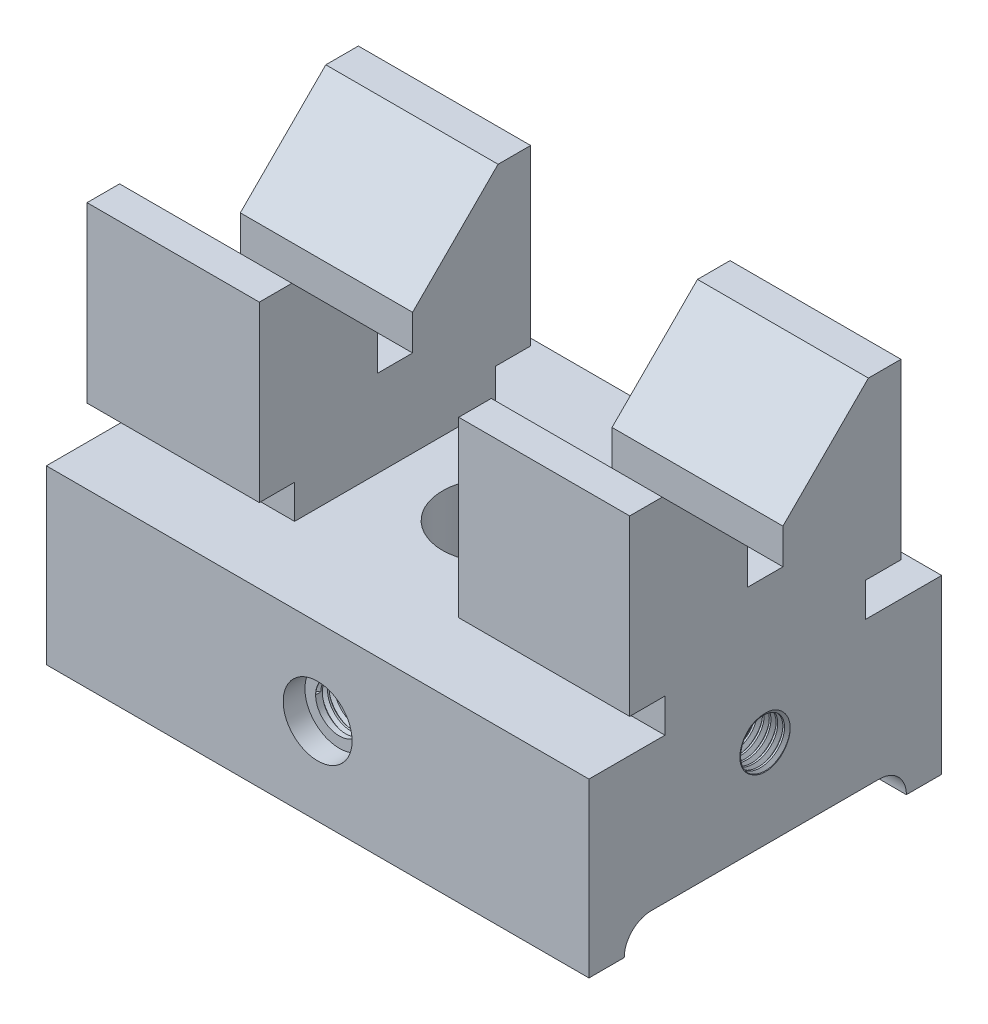
from build123d import *

# Parameters (mm, degrees)
SKETCH1_W                                = 65
SKETCH1_H                                = 70
BOSS_EXTRUDE1_DEPTH                      = 50
SKETCH2_W                                = 26
SKETCH2_H                                = 5
CUT_EXTRUDE1_DEPTH                       = 111.820801297
FILLET1_R                                = 5
CUT_EXTRUDE2_START                       = -31.75
CUT_EXTRUDE2_DEPTH                       = 36.75
SKETCH5_R                                = 9.5
CUT_EXTRUDE3_DEPTH                       = 71.847106504
CBORE_FOR_M10_HEX_HEAD_BOLT1_D           = 8.75
CBORE_FOR_M10_HEX_HEAD_BOLT1_DEPTH       = 20
CBORE_FOR_M10_HEX_HEAD_BOLT1_CBORE_D     = 12.7
CBORE_FOR_M10_HEX_HEAD_BOLT1_CBORE_DEPTH = 4
CBORE_FOR_M10_HEX_HEAD_BOLT1_TIP         = 2.628765208
THREAD1_PITCH                            = 1.25
F_8_7_8_7_DIAMETER_HOLE1_D               = 8.7
F_8_7_8_7_DIAMETER_HOLE1_DEPTH           = 16
F_8_7_8_7_DIAMETER_HOLE1_TIP             = 2.613743693
THREAD2_PITCH                            = 1.25


with BuildPart() as part:
    # Sketch1 → Boss-Extrude1 (new, symmetric)
    with BuildSketch(Plane(origin=(0, 0, 0), x_dir=(0, 0, -1), z_dir=(1, 0, 0))):
        Rectangle(SKETCH1_W, SKETCH1_H)
    extrude(amount=BOSS_EXTRUDE1_DEPTH, both=True)

    # Sketch2 → Cut-Extrude1 (cut, through all)
    with BuildSketch(Plane(origin=(50, 0, 0), x_dir=(0, 0, -1), z_dir=(1, 0, 0))):
        Polygon((-25, 18.646228615), (-25, 35), (-32.5, 35), (-32.5, -3.25), (-18.5, -3.25), (-18.5, 3), (-25, 3), align=None)
        Polygon((32.5, 35), (25, 35), (25, 18.646228615), (25, 3), (18.5, 3), (18.5, -3.25), (32.5, -3.25), align=None)
        Polygon((19, 35), (0, 35), (0, 12.75), (3.25, 12.75), (3.25, 19.25), align=None)
        Polygon((0, 12.75), (0, 35), (-19, 35), (-3.25, 19.25), (-3.25, 12.75), align=None)
        with Locations((13, -32.5)):
            Rectangle(SKETCH2_W, SKETCH2_H)
        with Locations((-13, -32.5)):
            Rectangle(SKETCH2_W, SKETCH2_H)
    extrude(amount=-CUT_EXTRUDE1_DEPTH, mode=Mode.SUBTRACT)

    # Fillet1
    fillet1_edges = [part.edges().sort_by_distance(p)[0] for p in [
        (0, -30, 26),
        (0, -30, -26),
    ]]
    fillet(fillet1_edges, radius=FILLET1_R - 0.0001)  # a hair under: the kernel refuses the full size

    # Sketch4 → Cut-Extrude2 (cut)
    with BuildSketch(Plane.ZY.offset(50).offset(CUT_EXTRUDE2_START)):
        Polygon((-18.5, -3.25), (18.5, -3.25), (18.5, 3), (25, 3), (25, 35), (19, 35), (3.25, 19.25), (3.25, 12.75), (-3.25, 12.75), (-3.25, 19.25), (-19, 35), (-25, 35), (-25, 3), (-18.5, 3), align=None)
    extrude(amount=-CUT_EXTRUDE2_DEPTH, mode=Mode.SUBTRACT)

    # Sketch5 → Cut-Extrude3 (cut, through all)
    with BuildSketch(Plane(origin=(0, -3.25, 0), x_dir=(1, 0, 0), z_dir=(0, 1, 0))):
        with Locations(Location((0, 0, 0), (0, 0, 270))):
            Circle(SKETCH5_R)
    extrude(amount=-CUT_EXTRUDE3_DEPTH, mode=Mode.SUBTRACT)

    # CBORE for M10 Hex Head Bolt1
    with Locations(Plane.XY.offset(32.5)):
        with Locations((0, -19)):
            CounterBoreHole(CBORE_FOR_M10_HEX_HEAD_BOLT1_D / 2, CBORE_FOR_M10_HEX_HEAD_BOLT1_CBORE_D / 2, CBORE_FOR_M10_HEX_HEAD_BOLT1_CBORE_DEPTH, depth=CBORE_FOR_M10_HEX_HEAD_BOLT1_DEPTH)
            with Locations((0, 0, -(CBORE_FOR_M10_HEX_HEAD_BOLT1_DEPTH + CBORE_FOR_M10_HEX_HEAD_BOLT1_TIP / 2))):  # 118° drill point
                Cone(0, CBORE_FOR_M10_HEX_HEAD_BOLT1_D / 2, CBORE_FOR_M10_HEX_HEAD_BOLT1_TIP, mode=Mode.SUBTRACT)

    # Thread1: the profile of Thread Profile1 profile screwed along a right-hand helix of 8 turns, 8 arcs to a turn; built about Z, then put on its axis
    thread1_z = Axis((0, 0, 0), (0, 0, 1))
    thread1_corners = [(4.3747, 0, -0.000173205), (5.051582344, 0, 0.390624998), (5.051582344, 0, 0.546874998), (4.3747, 0, 0.937673202)]
    with BuildLine(mode=Mode.PRIVATE) as thread1_profile:
        Line(thread1_corners[0], thread1_corners[1])
        Line(thread1_corners[1], thread1_corners[2])
        Line(thread1_corners[2], thread1_corners[3])
        Line(thread1_corners[3], thread1_corners[0])
    thread1_cap = Face(thread1_profile.wire())
    thread1_turn_angles = [0, 22.5, 45, 67.5, 90, 112.5, 135, 157.5, 180, 202.5, 225, 247.5, 270, 292.5, 315, 337.5, 360]
    thread1_turn_weights = [1, 0.9238795325112867, 1, 0.9238795325112867, 1, 0.9238795325112867, 1, 0.9238795325112867, 1, 0.9238795325112867, 1, 0.9238795325112867, 1, 0.9238795325112867, 1, 0.9238795325112867, 1]
    thread1_turn_rails = [Edge.make_bspline([Vector(p[0], p[1], 0).rotate(thread1_z, thread1_turn_angles[k]) / thread1_turn_weights[k] + Vector(0, 0, p[2] + THREAD1_PITCH * thread1_turn_angles[k] / 360) for k in range(17)], [0, 0, 0, 1, 1, 2, 2, 3, 3, 4, 4, 5, 5, 6, 6, 7, 7, 8, 8, 8], 2, thread1_turn_weights) for p in thread1_corners]
    thread1_turn_sides = [Face.make_surface_from_curves(thread1_turn_rails[p[0]], thread1_turn_rails[p[1]]) for p in [(0, 1), (1, 2), (2, 3), (3, 0)]]
    thread1 = Plane(origin=(0, -19, 28.5), x_dir=(-1, 0, 0), z_dir=(0, 0, -1)) * Solid(Shell([*[p.moved(Location((0, 0, THREAD1_PITCH * i))) for i in range(8) for p in thread1_turn_sides], thread1_cap, thread1_cap.rotate(thread1_z, 2880).moved(Location((0, 0, THREAD1_PITCH * 2880 / 360)))]))
    add(thread1, mode=Mode.SUBTRACT)

    # Ø8.7 (8.7) Diameter Hole1
    with Locations(Plane(origin=(50, 0, 0), x_dir=(0, 0, -1), z_dir=(1, 0, 0))):
        with Locations((0, -14)):
            Hole(F_8_7_8_7_DIAMETER_HOLE1_D / 2, depth=F_8_7_8_7_DIAMETER_HOLE1_DEPTH)
            with Locations((0, 0, -(F_8_7_8_7_DIAMETER_HOLE1_DEPTH + F_8_7_8_7_DIAMETER_HOLE1_TIP / 2))):  # 118° drill point
                Cone(0, F_8_7_8_7_DIAMETER_HOLE1_D / 2, F_8_7_8_7_DIAMETER_HOLE1_TIP, mode=Mode.SUBTRACT)

    # Thread2: the profile of Thread Profile2 profile screwed along a right-hand helix of 12.8 turns, 8 arcs to a turn; built about Z, then put on its axis
    thread2_z = Axis((0, 0, 0), (0, 0, 1))
    thread2_corners = [(4.3497, 0, -0.000173205), (5.026582344, 0, 0.390624998), (5.026582344, 0, 0.546874998), (4.3497, 0, 0.937673202)]
    with BuildLine(mode=Mode.PRIVATE) as thread2_profile:
        Line(thread2_corners[0], thread2_corners[1])
        Line(thread2_corners[1], thread2_corners[2])
        Line(thread2_corners[2], thread2_corners[3])
        Line(thread2_corners[3], thread2_corners[0])
    thread2_cap = Face(thread2_profile.wire())
    thread2_turn_angles = [0, 22.5, 45, 67.5, 90, 112.5, 135, 157.5, 180, 202.5, 225, 247.5, 270, 292.5, 315, 337.5, 360]
    thread2_turn_weights = [1, 0.9238795325112867, 1, 0.9238795325112867, 1, 0.9238795325112867, 1, 0.9238795325112867, 1, 0.9238795325112867, 1, 0.9238795325112867, 1, 0.9238795325112867, 1, 0.9238795325112867, 1]
    thread2_turn_rails = [Edge.make_bspline([Vector(p[0], p[1], 0).rotate(thread2_z, thread2_turn_angles[k]) / thread2_turn_weights[k] + Vector(0, 0, p[2] + THREAD2_PITCH * thread2_turn_angles[k] / 360) for k in range(17)], [0, 0, 0, 1, 1, 2, 2, 3, 3, 4, 4, 5, 5, 6, 6, 7, 7, 8, 8, 8], 2, thread2_turn_weights) for p in thread2_corners]
    thread2_turn_sides = [Face.make_surface_from_curves(thread2_turn_rails[p[0]], thread2_turn_rails[p[1]]) for p in [(0, 1), (1, 2), (2, 3), (3, 0)]]
    thread2_last_angles = [4320, 4342.5, 4365, 4387.5, 4410, 4432.5, 4455, 4477.5, 4500, 4522.5, 4545, 4567.5, 4590, 4599, 4608]
    thread2_last_weights = [1, 0.9238795325112867, 1, 0.9238795325112867, 1, 0.9238795325112867, 1, 0.9238795325112867, 1, 0.9238795325112867, 1, 0.9238795325112867, 1, 0.9876883405951378, 1]
    thread2_last_rails = [Edge.make_bspline([Vector(p[0], p[1], 0).rotate(thread2_z, thread2_last_angles[k]) / thread2_last_weights[k] + Vector(0, 0, p[2] + THREAD2_PITCH * thread2_last_angles[k] / 360) for k in range(15)], [0, 0, 0, 1, 1, 2, 2, 3, 3, 4, 4, 5, 5, 6, 6, 7, 7, 7], 2, thread2_last_weights) for p in thread2_corners]
    thread2_last_sides = [Face.make_surface_from_curves(thread2_last_rails[p[0]], thread2_last_rails[p[1]]) for p in [(0, 1), (1, 2), (2, 3), (3, 0)]]
    thread2 = Plane(origin=(52, -14, 0), x_dir=(0, 0, 1), z_dir=(-1, 0, 0)) * Solid(Shell([*[p.moved(Location((0, 0, THREAD2_PITCH * i))) for i in range(12) for p in thread2_turn_sides], *thread2_last_sides, thread2_cap, thread2_cap.rotate(thread2_z, 4608).moved(Location((0, 0, THREAD2_PITCH * 4608 / 360)))]))
    add(thread2, mode=Mode.SUBTRACT)


solid = part.part
